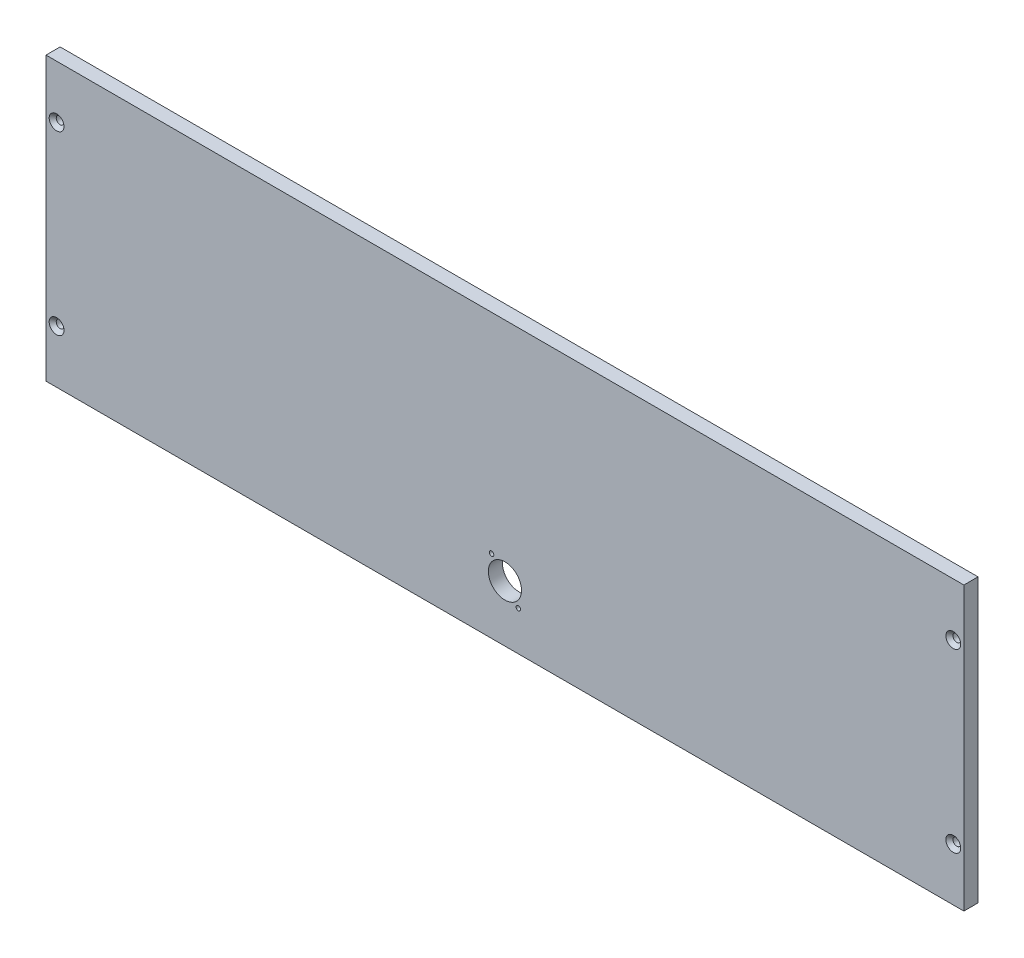
from build123d import *

# Parameters (mm, degrees)
ESQUISSE1_W             = 650
ESQUISSE1_H             = 200
BOSS_EXTRU_1_DEPTH      = 10
ESQUISSE2_R             = 2.75
ENL_V_MAT_EXTRU_1_DEPTH = 10
CHANFREIN1_SIZE         = 2.5
ESQUISSE3_R             = 1.6
ESQUISSE3_R_2           = 11.75
ENL_V_MAT_EXTRU_2_DEPTH = 10


with BuildPart() as part:
    # Esquisse1 → Boss.-Extru.1 (new body)
    with BuildSketch(Plane.XY):
        with Locations((325, 100)):
            Rectangle(ESQUISSE1_W, ESQUISSE1_H)
    extrude(amount=BOSS_EXTRU_1_DEPTH)

    # Esquisse2 → Enlèv. mat.-Extru.1 (cut)
    with BuildSketch(Plane.XY.offset(10)):
        with Locations((7.5, 162.5)):
            Circle(ESQUISSE2_R)
        with Locations((642.5, 162.5)):
            Circle(ESQUISSE2_R)
        with Locations((7.5, 37.5)):
            Circle(ESQUISSE2_R)
        with Locations((642.5, 37.5)):
            Circle(ESQUISSE2_R)
    extrude(amount=-ENL_V_MAT_EXTRU_1_DEPTH, mode=Mode.SUBTRACT)

    # Chanfrein1
    chanfrein1_edges = [part.edges().sort_by_distance(p)[0] for p in [
        (4.75, 162.5, 10),
        (4.75, 37.5, 10),
        (639.75, 37.5, 10),
        (639.75, 162.5, 10),
    ]]
    chamfer(chanfrein1_edges, length=CHANFREIN1_SIZE)

    # Esquisse3 → Enlèv. mat.-Extru.2 (cut)
    with BuildSketch(Plane.XY.offset(10)):
        with Locations((315.499614794, 51.999404399)):
            Circle(ESQUISSE3_R)
        with Locations((325, 40)):
            Circle(ESQUISSE3_R_2)
        with Locations((334.500385206, 28.000595601)):
            Circle(ESQUISSE3_R)
    extrude(amount=-ENL_V_MAT_EXTRU_2_DEPTH, mode=Mode.SUBTRACT)


solid = part.part
